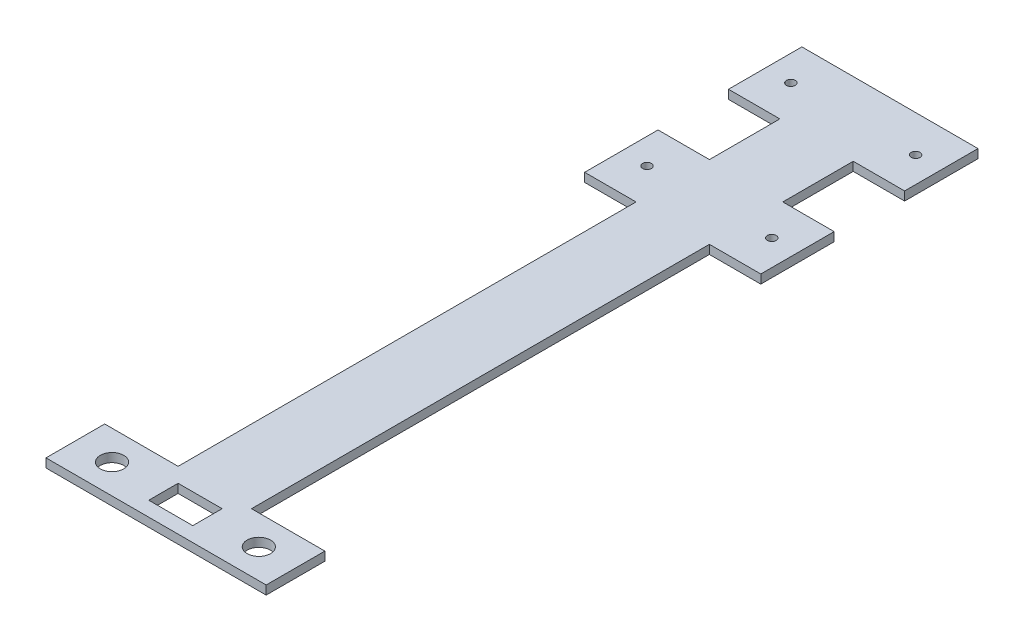
from build123d import *

# Parameters (mm, degrees)
BOSS_EXTRUDE1_DEPTH     = 3
CUT_EXTRUDE1_DEPTH      = 131.538308553
CUT_EXTRUDE1_DEPTH_BACK = 131.538308553
SKETCH2_R               = 1.5
CUT_EXTRUDE2_DEPTH      = 131.538308553
CUT_EXTRUDE2_DEPTH_BACK = 131.538308553
SKETCH3_R               = 4
SKETCH3_W               = 15
SKETCH3_H               = 10


with BuildPart() as part:
    # Sketch1 → Boss-Extrude1 (new body)
    with BuildSketch(Plane(origin=(0, 0, 0), x_dir=(1, 0, 0), z_dir=(0, 1, 0))):
        Polygon((30, 76), (12.5, 76), (12.5, 100), (30, 100), (30, 125), (-30, 125), (-30, 100), (-12.5, 100), (-12.5, 76), (-30, 76), (-30, 51), (-12.5, 51), (-12.5, -105), (-37.5, -105), (-37.5, -125), (37.5, -125), (37.5, -105), (12.5, -105), (12.5, 51), (30, 51), align=None)
    extrude(amount=BOSS_EXTRUDE1_DEPTH)

    # Sketch2 → Cut-Extrude1 (cut, two sides: drawn at the far end of the back side and taken through both)
    with BuildSketch(Plane(origin=(0, 3, 0), x_dir=(1, 0, 0), z_dir=(0, 1, 0)).offset(-CUT_EXTRUDE1_DEPTH_BACK)):
        with Locations((-21.25, 112.5)):
            Circle(SKETCH2_R)
        with Locations((21.25, 112.5)):
            Circle(SKETCH2_R)
        with Locations((-21.25, 63.5)):
            Circle(SKETCH2_R)
        with Locations((21.25, 63.5)):
            Circle(SKETCH2_R)
    extrude(amount=CUT_EXTRUDE1_DEPTH + CUT_EXTRUDE1_DEPTH_BACK, mode=Mode.SUBTRACT)

    # Sketch3 → Cut-Extrude2 (cut, two sides: drawn at the far end of the back side and taken through both)
    with BuildSketch(Plane(origin=(0, 3, 0), x_dir=(1, 0, 0), z_dir=(0, 1, 0)).offset(-CUT_EXTRUDE2_DEPTH_BACK)):
        with Locations((-25, -115)):
            Circle(SKETCH3_R)
        with Locations((25, -115)):
            Circle(SKETCH3_R)
        with Locations((0, -115)):
            Rectangle(SKETCH3_W, SKETCH3_H)
    extrude(amount=CUT_EXTRUDE2_DEPTH + CUT_EXTRUDE2_DEPTH_BACK, mode=Mode.SUBTRACT)


solid = part.part
